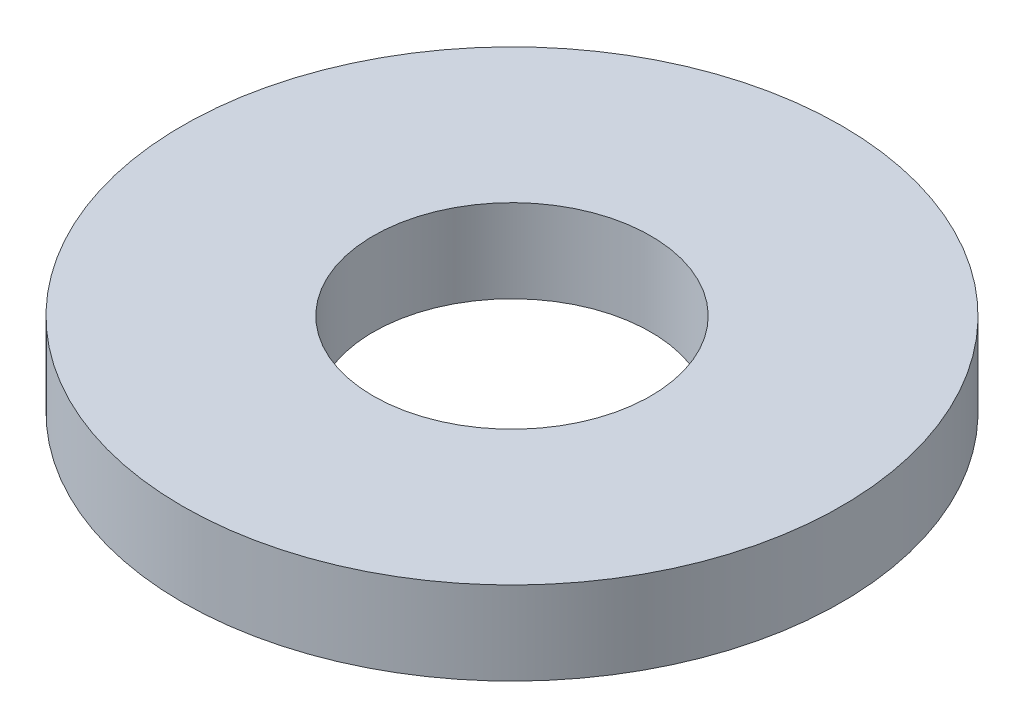
from build123d import *

# Parameters (mm, degrees)
SKETCH1_R           = 95
BOSS_EXTRUDE1_DEPTH = 24
SKETCH2_R           = 40
CUT_EXTRUDE1_DEPTH  = 137.477104307


with BuildPart() as part:
    # Sketch1 → Boss-Extrude1 (new body)
    with BuildSketch(Plane(origin=(0, 0, 0), x_dir=(1, 0, 0), z_dir=(0, 1, 0))):
        Circle(SKETCH1_R)
    extrude(amount=BOSS_EXTRUDE1_DEPTH)

    # Sketch2 → Cut-Extrude1 (cut, through all)
    with BuildSketch(Plane(origin=(0, 0, 0), x_dir=(1, 0, 0), z_dir=(0, 1, 0))):
        Circle(SKETCH2_R)
    extrude(amount=CUT_EXTRUDE1_DEPTH, mode=Mode.SUBTRACT)


solid = part.part
